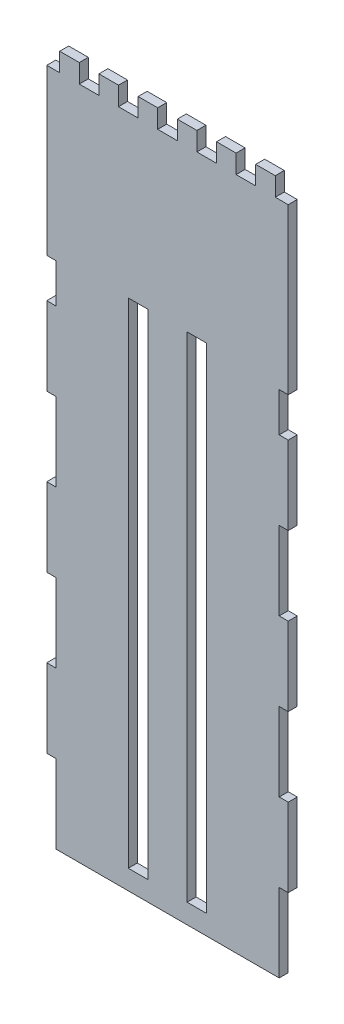
from build123d import *

# Parameters (mm, degrees)
SKETCH1_W           = 78.232
SKETCH1_H           = 218.44
BOSS_EXTRUDE1_DEPTH = 1.4605
SKETCH2_W           = 2.921
SKETCH2_H           = 25.4
SKETCH2_H_2         = 12.7
CUT_EXTRUDE1_DEPTH  = 2.921
SKETCH3_W           = 6.35
SKETCH3_H           = 2.921
BOSS_EXTRUDE2_DEPTH = 6.0452
SKETCH5_W           = 6.35
SKETCH5_H           = 160.02
CUT_EXTRUDE2_DEPTH  = 122.756560513


with BuildPart() as part:
    # Sketch1 → Boss-Extrude1 (new, symmetric)
    with BuildSketch(Plane.XY):
        Rectangle(SKETCH1_W, SKETCH1_H)
    extrude(amount=BOSS_EXTRUDE1_DEPTH, both=True)

    # Sketch2 → Cut-Extrude1 (cut)
    with BuildSketch(Plane.XY.offset(1.4605)):
        with Locations((-37.6555, -96.52)):
            Rectangle(SKETCH2_W, SKETCH2_H)
        with Locations((37.6555, -96.52)):
            Rectangle(SKETCH2_W, SKETCH2_H)
        with Locations((-37.6555, -45.72)):
            Rectangle(SKETCH2_W, SKETCH2_H)
        with Locations((37.6555, -45.72)):
            Rectangle(SKETCH2_W, SKETCH2_H)
        with Locations((-37.6555, 5.08)):
            Rectangle(SKETCH2_W, SKETCH2_H)
        with Locations((37.6555, 5.08)):
            Rectangle(SKETCH2_W, SKETCH2_H)
        with Locations((-37.6555, 49.53)):
            Rectangle(SKETCH2_W, SKETCH2_H_2)
        with Locations((37.6555, 49.53)):
            Rectangle(SKETCH2_W, SKETCH2_H_2)
    extrude(amount=-CUT_EXTRUDE1_DEPTH, mode=Mode.SUBTRACT)

    # Sketch3 → Boss-Extrude2 (add)
    with BuildSketch(Plane(origin=(0, 109.22, 0), x_dir=(1, 0, 0), z_dir=(0, 1, 0))):
        with Locations((31.75, 0)):
            Rectangle(SKETCH3_W, SKETCH3_H)
        with Locations((19.05, 0)):
            Rectangle(SKETCH3_W, SKETCH3_H)
        with Locations((6.35, 0)):
            Rectangle(SKETCH3_W, SKETCH3_H)
        with Locations((-6.35, 0)):
            Rectangle(SKETCH3_W, SKETCH3_H)
        with Locations((-19.05, 0)):
            Rectangle(SKETCH3_W, SKETCH3_H)
        with Locations((-31.75, 0)):
            Rectangle(SKETCH3_W, SKETCH3_H)
    extrude(amount=BOSS_EXTRUDE2_DEPTH)

    # Sketch5 → Cut-Extrude2 (cut, through all)
    with BuildSketch(Plane.XY.offset(1.4605)):
        with Locations((-9.525, -22.86)):
            Rectangle(SKETCH5_W, SKETCH5_H)
        with Locations((9.525, -22.86)):
            Rectangle(SKETCH5_W, SKETCH5_H)
    extrude(amount=-CUT_EXTRUDE2_DEPTH, mode=Mode.SUBTRACT)


solid = part.part
